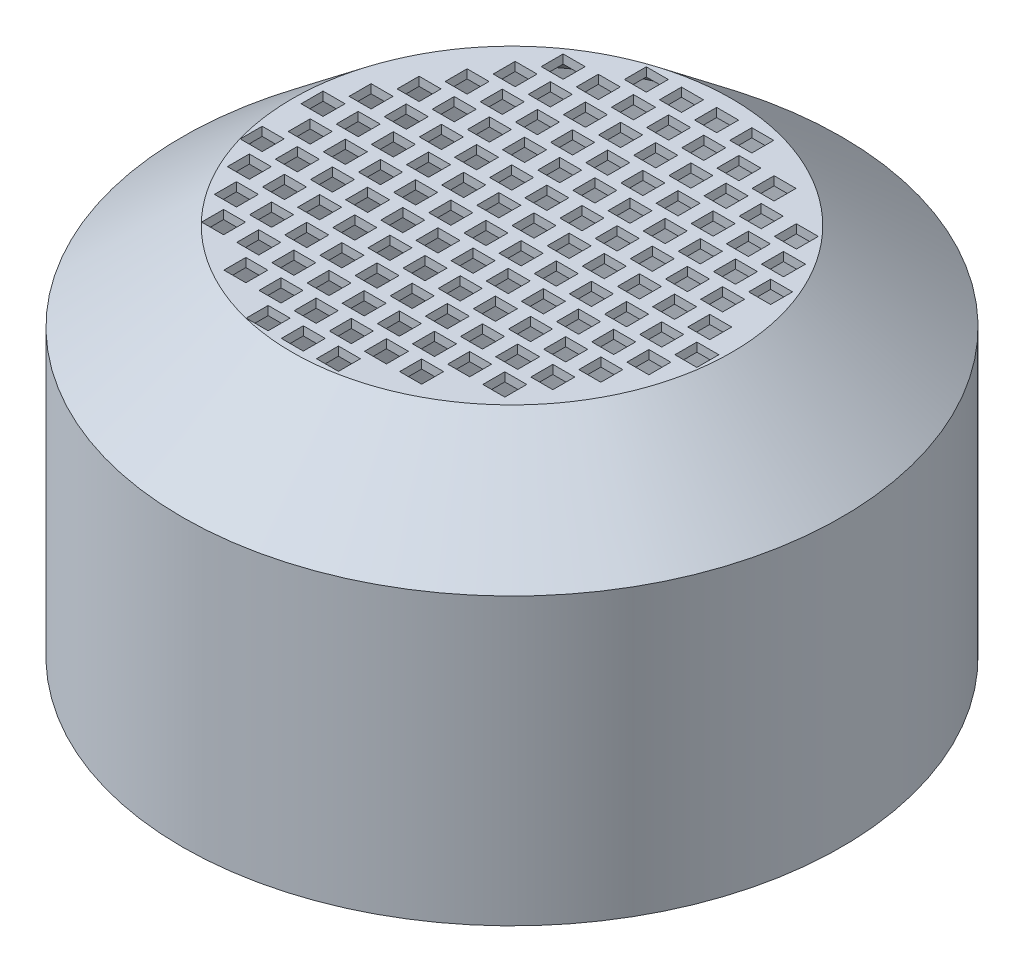
from build123d import *

# Parameters (mm, degrees)
SKETCH1_R               = 7.5
BOSS_EXTRUDE1_DEPTH     = 8.5
CHAMFER1_SIZE           = 2
CHAMFER1_SIZE2          = 2.5
SHELL1_T                = -0.2
SKETCH2_W               = 0.5
SKETCH2_H               = 0.5
CUT_EXTRUDE1_DEPTH      = 0.2
FILL_START              = 8.3
FILL_PATTERN1_OUTLINE_W = 0.5
FILL_PATTERN1_OUTLINE_H = 0.5
FILL_PATTERN1_DEPTH     = 0.2
EXTRUDE_THIN1_REACH     = 15.592
SKETCH4_R               = 6.65
SKETCH4_R_2             = 6.5


# Read off the part's stored shape, not the designer's step: Fill Pattern1
with BuildPart() as part:
    # Sketch1 → Boss-Extrude1 (new body)
    with BuildSketch(Plane(origin=(0, 0, 0), x_dir=(1, 0, 0), z_dir=(0, 1, 0))):
        with Locations(Location((0, 0, 0), (0, 0, 270))):
            Circle(SKETCH1_R)
    extrude(amount=BOSS_EXTRUDE1_DEPTH)

    # Chamfer1
    chamfer1_edges = [part.edges().sort_by_distance(p)[0] for p in [
        (0, 8.5, -7.5),
    ]]
    chamfer1_side = [part.faces().sort_by_distance(p)[0] for p in [
        (0, 4.25, -7.5),
    ]]
    chamfer(chamfer1_edges, length=CHAMFER1_SIZE, length2=CHAMFER1_SIZE2, reference=chamfer1_side[0])

    # Shell1
    shell1_openings = [part.faces().sort_by_distance(p)[0] for p in [
        (0, 0, 0),
    ]]
    offset(amount=SHELL1_T, openings=shell1_openings, kind=Kind.INTERSECTION)

    # Sketch2 → Cut-Extrude1 (cut)
    with BuildSketch(Plane(origin=(0, 8.5, 0), x_dir=(1, 0, 0), z_dir=(0, 1, 0))):
        with Locations((0.25, 0.25)):
            Rectangle(SKETCH2_W, SKETCH2_H)
    extrude(amount=-CUT_EXTRUDE1_DEPTH, mode=Mode.SUBTRACT)

    # Fill Pattern1 outline → Fill Pattern1 (cut)
    with BuildSketch(Plane(origin=(0, 0, 0), x_dir=(1, 0, 0), z_dir=(0, 1, 0)).offset(FILL_START)):
        with Locations((0.25, 4.406921938)):
            Rectangle(FILL_PATTERN1_OUTLINE_W, FILL_PATTERN1_OUTLINE_H)
        with Locations((0.25, 1.635640646)):
            Rectangle(FILL_PATTERN1_OUTLINE_W, FILL_PATTERN1_OUTLINE_H)
        with Locations((0.25, 3.021281292)):
            Rectangle(FILL_PATTERN1_OUTLINE_W, FILL_PATTERN1_OUTLINE_H)
        with Locations((0.25, -3.906921938)):
            Rectangle(FILL_PATTERN1_OUTLINE_W, FILL_PATTERN1_OUTLINE_H)
        with Locations((0.25, -1.135640646)):
            Rectangle(FILL_PATTERN1_OUTLINE_W, FILL_PATTERN1_OUTLINE_H)
        with Locations((0.25, -2.521281292)):
            Rectangle(FILL_PATTERN1_OUTLINE_W, FILL_PATTERN1_OUTLINE_H)
        with Locations((-1.35, 0.25)):
            Rectangle(FILL_PATTERN1_OUTLINE_W, FILL_PATTERN1_OUTLINE_H)
        with Locations((-2.15, 0.25)):
            Rectangle(FILL_PATTERN1_OUTLINE_W, FILL_PATTERN1_OUTLINE_H)
        with Locations((-0.55, 0.25)):
            Rectangle(FILL_PATTERN1_OUTLINE_W, FILL_PATTERN1_OUTLINE_H)
        with Locations((-3.75, 0.25)):
            Rectangle(FILL_PATTERN1_OUTLINE_W, FILL_PATTERN1_OUTLINE_H)
        with Locations((-4.55, 0.25)):
            Rectangle(FILL_PATTERN1_OUTLINE_W, FILL_PATTERN1_OUTLINE_H)
        with Locations((-2.95, 0.25)):
            Rectangle(FILL_PATTERN1_OUTLINE_W, FILL_PATTERN1_OUTLINE_H)
        with Locations((2.65, 0.25)):
            Rectangle(FILL_PATTERN1_OUTLINE_W, FILL_PATTERN1_OUTLINE_H)
        with Locations((4.25, 0.25)):
            Rectangle(FILL_PATTERN1_OUTLINE_W, FILL_PATTERN1_OUTLINE_H)
        with Locations((3.45, 0.25)):
            Rectangle(FILL_PATTERN1_OUTLINE_W, FILL_PATTERN1_OUTLINE_H)
        with Locations((1.05, 0.25)):
            Rectangle(FILL_PATTERN1_OUTLINE_W, FILL_PATTERN1_OUTLINE_H)
        with Locations((1.85, 0.25)):
            Rectangle(FILL_PATTERN1_OUTLINE_W, FILL_PATTERN1_OUTLINE_H)
        with Locations((4.65, -0.442820323)):
            Rectangle(FILL_PATTERN1_OUTLINE_W, FILL_PATTERN1_OUTLINE_H)
        with Locations((-1.75, -0.442820323)):
            Rectangle(FILL_PATTERN1_OUTLINE_W, FILL_PATTERN1_OUTLINE_H)
        with Locations((-0.95, -0.442820323)):
            Rectangle(FILL_PATTERN1_OUTLINE_W, FILL_PATTERN1_OUTLINE_H)
        with Locations((-4.15, -0.442820323)):
            Rectangle(FILL_PATTERN1_OUTLINE_W, FILL_PATTERN1_OUTLINE_H)
        with Locations((-2.55, -0.442820323)):
            Rectangle(FILL_PATTERN1_OUTLINE_W, FILL_PATTERN1_OUTLINE_H)
        with Locations((-3.35, -0.442820323)):
            Rectangle(FILL_PATTERN1_OUTLINE_W, FILL_PATTERN1_OUTLINE_H)
        with Locations((2.25, -0.442820323)):
            Rectangle(FILL_PATTERN1_OUTLINE_W, FILL_PATTERN1_OUTLINE_H)
        with Locations((3.85, -0.442820323)):
            Rectangle(FILL_PATTERN1_OUTLINE_W, FILL_PATTERN1_OUTLINE_H)
        with Locations((3.05, -0.442820323)):
            Rectangle(FILL_PATTERN1_OUTLINE_W, FILL_PATTERN1_OUTLINE_H)
        with Locations((0.65, -0.442820323)):
            Rectangle(FILL_PATTERN1_OUTLINE_W, FILL_PATTERN1_OUTLINE_H)
        with Locations((-0.15, -0.442820323)):
            Rectangle(FILL_PATTERN1_OUTLINE_W, FILL_PATTERN1_OUTLINE_H)
        with Locations((1.45, -0.442820323)):
            Rectangle(FILL_PATTERN1_OUTLINE_W, FILL_PATTERN1_OUTLINE_H)
        with Locations((-3.35, -3.214101615)):
            Rectangle(FILL_PATTERN1_OUTLINE_W, FILL_PATTERN1_OUTLINE_H)
        with Locations((-3.35, 0.942820323)):
            Rectangle(FILL_PATTERN1_OUTLINE_W, FILL_PATTERN1_OUTLINE_H)
        with Locations((-3.35, 2.328460969)):
            Rectangle(FILL_PATTERN1_OUTLINE_W, FILL_PATTERN1_OUTLINE_H)
        with Locations((-3.35, -1.828460969)):
            Rectangle(FILL_PATTERN1_OUTLINE_W, FILL_PATTERN1_OUTLINE_H)
        with Locations((-1.75, -3.214101615)):
            Rectangle(FILL_PATTERN1_OUTLINE_W, FILL_PATTERN1_OUTLINE_H)
        with Locations((-2.55, -3.214101615)):
            Rectangle(FILL_PATTERN1_OUTLINE_W, FILL_PATTERN1_OUTLINE_H)
        with Locations((1.45, -3.214101615)):
            Rectangle(FILL_PATTERN1_OUTLINE_W, FILL_PATTERN1_OUTLINE_H)
        with Locations((0.65, -3.214101615)):
            Rectangle(FILL_PATTERN1_OUTLINE_W, FILL_PATTERN1_OUTLINE_H)
        with Locations((3.05, -3.214101615)):
            Rectangle(FILL_PATTERN1_OUTLINE_W, FILL_PATTERN1_OUTLINE_H)
        with Locations((2.25, -3.214101615)):
            Rectangle(FILL_PATTERN1_OUTLINE_W, FILL_PATTERN1_OUTLINE_H)
        with Locations((-0.95, -3.214101615)):
            Rectangle(FILL_PATTERN1_OUTLINE_W, FILL_PATTERN1_OUTLINE_H)
        with Locations((-0.15, -3.214101615)):
            Rectangle(FILL_PATTERN1_OUTLINE_W, FILL_PATTERN1_OUTLINE_H)
        with Locations((-4.55, -1.135640646)):
            Rectangle(FILL_PATTERN1_OUTLINE_W, FILL_PATTERN1_OUTLINE_H)
        with Locations((-2.15, -1.135640646)):
            Rectangle(FILL_PATTERN1_OUTLINE_W, FILL_PATTERN1_OUTLINE_H)
        with Locations((-1.35, -1.135640646)):
            Rectangle(FILL_PATTERN1_OUTLINE_W, FILL_PATTERN1_OUTLINE_H)
        with Locations((-2.95, -1.135640646)):
            Rectangle(FILL_PATTERN1_OUTLINE_W, FILL_PATTERN1_OUTLINE_H)
        with Locations((-3.75, -1.135640646)):
            Rectangle(FILL_PATTERN1_OUTLINE_W, FILL_PATTERN1_OUTLINE_H)
        with Locations((1.85, -1.135640646)):
            Rectangle(FILL_PATTERN1_OUTLINE_W, FILL_PATTERN1_OUTLINE_H)
        with Locations((3.45, -1.135640646)):
            Rectangle(FILL_PATTERN1_OUTLINE_W, FILL_PATTERN1_OUTLINE_H)
        with Locations((4.25, -1.135640646)):
            Rectangle(FILL_PATTERN1_OUTLINE_W, FILL_PATTERN1_OUTLINE_H)
        with Locations((2.65, -1.135640646)):
            Rectangle(FILL_PATTERN1_OUTLINE_W, FILL_PATTERN1_OUTLINE_H)
        with Locations((-0.55, -1.135640646)):
            Rectangle(FILL_PATTERN1_OUTLINE_W, FILL_PATTERN1_OUTLINE_H)
        with Locations((1.05, -1.135640646)):
            Rectangle(FILL_PATTERN1_OUTLINE_W, FILL_PATTERN1_OUTLINE_H)
        with Locations((0.65, -4.599742261)):
            Rectangle(FILL_PATTERN1_OUTLINE_W, FILL_PATTERN1_OUTLINE_H)
        with Locations((0.65, 2.328460969)):
            Rectangle(FILL_PATTERN1_OUTLINE_W, FILL_PATTERN1_OUTLINE_H)
        with Locations((0.65, 3.714101615)):
            Rectangle(FILL_PATTERN1_OUTLINE_W, FILL_PATTERN1_OUTLINE_H)
        with Locations((0.65, 0.942820323)):
            Rectangle(FILL_PATTERN1_OUTLINE_W, FILL_PATTERN1_OUTLINE_H)
        with Locations((0.65, -1.828460969)):
            Rectangle(FILL_PATTERN1_OUTLINE_W, FILL_PATTERN1_OUTLINE_H)
        with Locations((-0.95, -4.599742261)):
            Rectangle(FILL_PATTERN1_OUTLINE_W, FILL_PATTERN1_OUTLINE_H)
        with Locations((-0.15, -4.599742261)):
            Rectangle(FILL_PATTERN1_OUTLINE_W, FILL_PATTERN1_OUTLINE_H)
        with Locations((3.45, 3.021281292)):
            Rectangle(FILL_PATTERN1_OUTLINE_W, FILL_PATTERN1_OUTLINE_H)
        with Locations((3.45, 1.635640646)):
            Rectangle(FILL_PATTERN1_OUTLINE_W, FILL_PATTERN1_OUTLINE_H)
        with Locations((3.45, -2.521281292)):
            Rectangle(FILL_PATTERN1_OUTLINE_W, FILL_PATTERN1_OUTLINE_H)
        with Locations((-0.55, 3.021281292)):
            Rectangle(FILL_PATTERN1_OUTLINE_W, FILL_PATTERN1_OUTLINE_H)
        with Locations((1.05, 3.021281292)):
            Rectangle(FILL_PATTERN1_OUTLINE_W, FILL_PATTERN1_OUTLINE_H)
        with Locations((-2.15, 3.021281292)):
            Rectangle(FILL_PATTERN1_OUTLINE_W, FILL_PATTERN1_OUTLINE_H)
        with Locations((-2.95, 3.021281292)):
            Rectangle(FILL_PATTERN1_OUTLINE_W, FILL_PATTERN1_OUTLINE_H)
        with Locations((-1.35, 3.021281292)):
            Rectangle(FILL_PATTERN1_OUTLINE_W, FILL_PATTERN1_OUTLINE_H)
        with Locations((1.85, 3.021281292)):
            Rectangle(FILL_PATTERN1_OUTLINE_W, FILL_PATTERN1_OUTLINE_H)
        with Locations((2.65, 3.021281292)):
            Rectangle(FILL_PATTERN1_OUTLINE_W, FILL_PATTERN1_OUTLINE_H)
        with Locations((-0.95, 0.942820323)):
            Rectangle(FILL_PATTERN1_OUTLINE_W, FILL_PATTERN1_OUTLINE_H)
        with Locations((-0.95, 2.328460969)):
            Rectangle(FILL_PATTERN1_OUTLINE_W, FILL_PATTERN1_OUTLINE_H)
        with Locations((-0.95, 3.714101615)):
            Rectangle(FILL_PATTERN1_OUTLINE_W, FILL_PATTERN1_OUTLINE_H)
        with Locations((-0.95, -1.828460969)):
            Rectangle(FILL_PATTERN1_OUTLINE_W, FILL_PATTERN1_OUTLINE_H)
        with Locations((-0.15, 2.328460969)):
            Rectangle(FILL_PATTERN1_OUTLINE_W, FILL_PATTERN1_OUTLINE_H)
        with Locations((-0.15, 3.714101615)):
            Rectangle(FILL_PATTERN1_OUTLINE_W, FILL_PATTERN1_OUTLINE_H)
        with Locations((-0.15, 0.942820323)):
            Rectangle(FILL_PATTERN1_OUTLINE_W, FILL_PATTERN1_OUTLINE_H)
        with Locations((-0.15, -1.828460969)):
            Rectangle(FILL_PATTERN1_OUTLINE_W, FILL_PATTERN1_OUTLINE_H)
        with Locations((-2.55, 2.328460969)):
            Rectangle(FILL_PATTERN1_OUTLINE_W, FILL_PATTERN1_OUTLINE_H)
        with Locations((-1.75, 2.328460969)):
            Rectangle(FILL_PATTERN1_OUTLINE_W, FILL_PATTERN1_OUTLINE_H)
        with Locations((3.85, 2.328460969)):
            Rectangle(FILL_PATTERN1_OUTLINE_W, FILL_PATTERN1_OUTLINE_H)
        with Locations((1.45, 2.328460969)):
            Rectangle(FILL_PATTERN1_OUTLINE_W, FILL_PATTERN1_OUTLINE_H)
        with Locations((3.05, 2.328460969)):
            Rectangle(FILL_PATTERN1_OUTLINE_W, FILL_PATTERN1_OUTLINE_H)
        with Locations((2.25, 2.328460969)):
            Rectangle(FILL_PATTERN1_OUTLINE_W, FILL_PATTERN1_OUTLINE_H)
        with Locations((-0.55, 1.635640646)):
            Rectangle(FILL_PATTERN1_OUTLINE_W, FILL_PATTERN1_OUTLINE_H)
        with Locations((-0.55, 4.406921938)):
            Rectangle(FILL_PATTERN1_OUTLINE_W, FILL_PATTERN1_OUTLINE_H)
        with Locations((-0.55, -2.521281292)):
            Rectangle(FILL_PATTERN1_OUTLINE_W, FILL_PATTERN1_OUTLINE_H)
        with Locations((-0.55, -3.906921938)):
            Rectangle(FILL_PATTERN1_OUTLINE_W, FILL_PATTERN1_OUTLINE_H)
        with Locations((-1.35, 1.635640646)):
            Rectangle(FILL_PATTERN1_OUTLINE_W, FILL_PATTERN1_OUTLINE_H)
        with Locations((-2.95, 1.635640646)):
            Rectangle(FILL_PATTERN1_OUTLINE_W, FILL_PATTERN1_OUTLINE_H)
        with Locations((-3.75, 1.635640646)):
            Rectangle(FILL_PATTERN1_OUTLINE_W, FILL_PATTERN1_OUTLINE_H)
        with Locations((-2.15, 1.635640646)):
            Rectangle(FILL_PATTERN1_OUTLINE_W, FILL_PATTERN1_OUTLINE_H)
        with Locations((4.25, 1.635640646)):
            Rectangle(FILL_PATTERN1_OUTLINE_W, FILL_PATTERN1_OUTLINE_H)
        with Locations((1.05, 1.635640646)):
            Rectangle(FILL_PATTERN1_OUTLINE_W, FILL_PATTERN1_OUTLINE_H)
        with Locations((2.65, 1.635640646)):
            Rectangle(FILL_PATTERN1_OUTLINE_W, FILL_PATTERN1_OUTLINE_H)
        with Locations((1.85, 1.635640646)):
            Rectangle(FILL_PATTERN1_OUTLINE_W, FILL_PATTERN1_OUTLINE_H)
        with Locations((-1.75, 0.942820323)):
            Rectangle(FILL_PATTERN1_OUTLINE_W, FILL_PATTERN1_OUTLINE_H)
        with Locations((-4.15, 0.942820323)):
            Rectangle(FILL_PATTERN1_OUTLINE_W, FILL_PATTERN1_OUTLINE_H)
        with Locations((-2.55, 0.942820323)):
            Rectangle(FILL_PATTERN1_OUTLINE_W, FILL_PATTERN1_OUTLINE_H)
        with Locations((3.05, 0.942820323)):
            Rectangle(FILL_PATTERN1_OUTLINE_W, FILL_PATTERN1_OUTLINE_H)
        with Locations((3.85, 0.942820323)):
            Rectangle(FILL_PATTERN1_OUTLINE_W, FILL_PATTERN1_OUTLINE_H)
        with Locations((2.25, 0.942820323)):
            Rectangle(FILL_PATTERN1_OUTLINE_W, FILL_PATTERN1_OUTLINE_H)
        with Locations((1.45, 0.942820323)):
            Rectangle(FILL_PATTERN1_OUTLINE_W, FILL_PATTERN1_OUTLINE_H)
        with Locations((-1.35, 4.406921938)):
            Rectangle(FILL_PATTERN1_OUTLINE_W, FILL_PATTERN1_OUTLINE_H)
        with Locations((-1.35, -3.906921938)):
            Rectangle(FILL_PATTERN1_OUTLINE_W, FILL_PATTERN1_OUTLINE_H)
        with Locations((-1.35, -2.521281292)):
            Rectangle(FILL_PATTERN1_OUTLINE_W, FILL_PATTERN1_OUTLINE_H)
        with Locations((-1.75, -1.828460969)):
            Rectangle(FILL_PATTERN1_OUTLINE_W, FILL_PATTERN1_OUTLINE_H)
        with Locations((-1.75, 3.714101615)):
            Rectangle(FILL_PATTERN1_OUTLINE_W, FILL_PATTERN1_OUTLINE_H)
        with Locations((-2.15, -3.906921938)):
            Rectangle(FILL_PATTERN1_OUTLINE_W, FILL_PATTERN1_OUTLINE_H)
        with Locations((-2.15, -2.521281292)):
            Rectangle(FILL_PATTERN1_OUTLINE_W, FILL_PATTERN1_OUTLINE_H)
        with Locations((-2.55, -1.828460969)):
            Rectangle(FILL_PATTERN1_OUTLINE_W, FILL_PATTERN1_OUTLINE_H)
        with Locations((-2.55, 3.714101615)):
            Rectangle(FILL_PATTERN1_OUTLINE_W, FILL_PATTERN1_OUTLINE_H)
        with Locations((-4.15, -1.828460969)):
            Rectangle(FILL_PATTERN1_OUTLINE_W, FILL_PATTERN1_OUTLINE_H)
        with Locations((2.25, -1.828460969)):
            Rectangle(FILL_PATTERN1_OUTLINE_W, FILL_PATTERN1_OUTLINE_H)
        with Locations((1.45, -1.828460969)):
            Rectangle(FILL_PATTERN1_OUTLINE_W, FILL_PATTERN1_OUTLINE_H)
        with Locations((3.05, -1.828460969)):
            Rectangle(FILL_PATTERN1_OUTLINE_W, FILL_PATTERN1_OUTLINE_H)
        with Locations((3.85, -1.828460969)):
            Rectangle(FILL_PATTERN1_OUTLINE_W, FILL_PATTERN1_OUTLINE_H)
        with Locations((-2.95, -2.521281292)):
            Rectangle(FILL_PATTERN1_OUTLINE_W, FILL_PATTERN1_OUTLINE_H)
        with Locations((-3.75, -2.521281292)):
            Rectangle(FILL_PATTERN1_OUTLINE_W, FILL_PATTERN1_OUTLINE_H)
        with Locations((1.85, -2.521281292)):
            Rectangle(FILL_PATTERN1_OUTLINE_W, FILL_PATTERN1_OUTLINE_H)
        with Locations((1.05, -2.521281292)):
            Rectangle(FILL_PATTERN1_OUTLINE_W, FILL_PATTERN1_OUTLINE_H)
        with Locations((2.65, -2.521281292)):
            Rectangle(FILL_PATTERN1_OUTLINE_W, FILL_PATTERN1_OUTLINE_H)
        with Locations((1.05, 4.406921938)):
            Rectangle(FILL_PATTERN1_OUTLINE_W, FILL_PATTERN1_OUTLINE_H)
        with Locations((1.45, 3.714101615)):
            Rectangle(FILL_PATTERN1_OUTLINE_W, FILL_PATTERN1_OUTLINE_H)
        with Locations((2.25, 3.714101615)):
            Rectangle(FILL_PATTERN1_OUTLINE_W, FILL_PATTERN1_OUTLINE_H)
        with Locations((1.05, -3.906921938)):
            Rectangle(FILL_PATTERN1_OUTLINE_W, FILL_PATTERN1_OUTLINE_H)
        with Locations((1.85, -3.906921938)):
            Rectangle(FILL_PATTERN1_OUTLINE_W, FILL_PATTERN1_OUTLINE_H)
    extrude(amount=FILL_PATTERN1_DEPTH, mode=Mode.SUBTRACT)

    # Extrude-Thin1: up to this cone (the profile starts inside it)
    extrude_thin1_end = Plane(origin=(0, 0, 0), z_dir=(0, -1, 0)).offset(-12.243874031) * Cone(1.25e-06, 54.550898523, 43.640717819, align=(Align.CENTER, Align.CENTER, Align.MIN), mode=Mode.PRIVATE)
    # Sketch4 → Extrude-Thin1 (add, up to the surface)
    with BuildSketch(Plane.XZ, mode=Mode.PRIVATE) as extrude_thin1_sk1:
        Circle(SKETCH4_R)
        Circle(SKETCH4_R_2, mode=Mode.SUBTRACT)
    extrude_thin1_tool1 = extrude(extrude_thin1_sk1.sketch, amount=-EXTRUDE_THIN1_REACH, mode=Mode.PRIVATE) & extrude_thin1_end
    add(extrude_thin1_tool1.solids().sort_by_distance((-6.631191, 0, 0))[0])


solid = part.part
